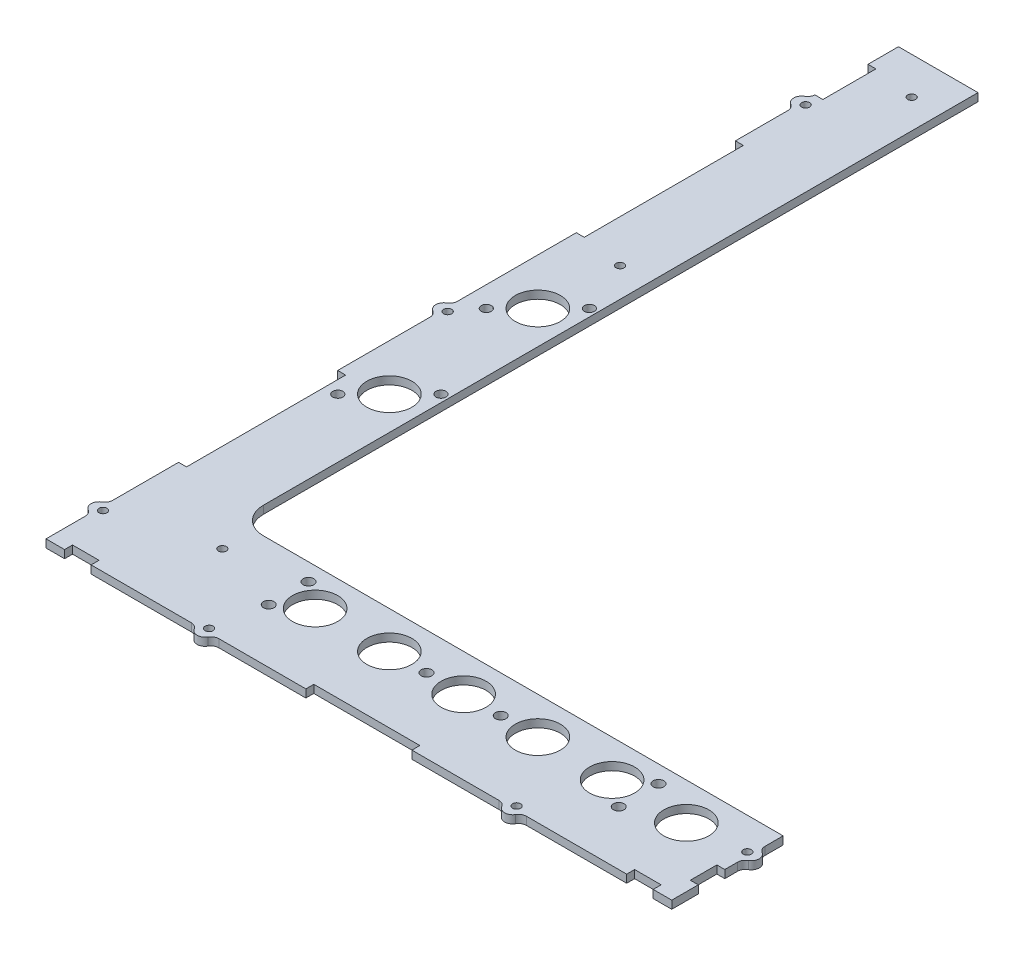
from build123d import *

# Parameters (mm, degrees)
EXTRUDE_1_DEPTH        = 3
SKETCH_2_W             = 3
SKETCH_2_H             = 10
CUT_EXTRUDE_1_DEPTH    = 3
SKETCH_4_W             = 3
SKETCH_4_H             = 3
FILLET_1_R             = 3
SKETCH_5_R             = 1.5
CUT_EXTRUDE_2_DEPTH    = 3
SKETCH_6_W             = 10
SKETCH_6_H             = 3
CUT_EXTRUDE_3_DEPTH    = 3
SKETCH_7_W             = 40
SKETCH_7_H             = 3
CUT_EXTRUDE_4_DEPTH    = 3
SKETCH_9_W             = 3
SKETCH_9_H             = 60
SKETCH_9_H_2           = 20
CUT_EXTRUDE_5_DEPTH    = 3
SKETCH_11_W            = 3
SKETCH_11_H            = 3
SKETCH_12_W            = 3
SKETCH_12_H            = 3
SKETCH_13_R            = 1.5
CUT_EXTRUDE_6_DEPTH    = 3
FILLET_2_R             = 3
SKETCH_14_W            = 3
SKETCH_14_H            = 3
SKETCH_15_W            = 3
SKETCH_15_H            = 3
SKETCH_16_W            = 3
SKETCH_16_H            = 3
FILLET_3_R             = 3
SKETCH_17_R            = 1.5
CUT_EXTRUDE_7_DEPTH    = 3
SKETCH_18_R            = 8.5
CUT_EXTRUDE_8_DEPTH    = 3
PATTERN_LINEAR_2_COUNT = 6
PATTERN_LINEAR_2_PITCH = 28
SKETCH_19_R            = 8.5
CUT_EXTRUDE_9_DEPTH    = 3
SKETCH_20_R            = 8.5
CUT_EXTRUDE_10_DEPTH   = 3
FILLET_4_R             = 10
SKETCH_21_R            = 2
CUT_EXTRUDE_11_DEPTH   = 3
SKETCH_22_R            = 1.9
CUT_EXTRUDE_12_DEPTH   = 3
SKETCH_23_R            = 1.5
CUT_EXTRUDE_13_DEPTH   = 3
SKETCH_24_R            = 1.5
CUT_EXTRUDE_14_DEPTH   = 3


with BuildPart() as part:
    # Эскиз1 → Бобышка-Вытянуть1 (new body)
    with BuildSketch(Plane(origin=(0, 0, 0), x_dir=(1, 0, 0), z_dir=(0, 1, 0))):
        Polygon((0, 0), (0, 321.5), (30, 321.5), (30, 42), (236, 42), (236, 0), align=None)
    extrude(amount=EXTRUDE_1_DEPTH)

    # Эскиз2 → Вырез-Вытянуть1 (cut)
    with BuildSketch(Plane(origin=(0, 3, 0), x_dir=(1, 0, 0), z_dir=(0, 1, 0))):
        with Locations((234.5, 15)):
            Rectangle(SKETCH_2_W, SKETCH_2_H)
    extrude(amount=-CUT_EXTRUDE_1_DEPTH, mode=Mode.SUBTRACT)

    # Эскиз4 → Повернуть1 (revolve)
    with BuildSketch(Plane(origin=(236, 0, 0), x_dir=(0, 0, -1), z_dir=(1, 0, 0))):
        with Locations((31.5, 1.5)):
            Rectangle(SKETCH_4_W, SKETCH_4_H)
    revolve(axis=Axis((236, 0, -30), (0, 1, 0)))

    # Скругление1
    fillet_1_edges = [part.edges().sort_by_distance(p)[0] for p in [
        (236, 1.5, -33),
        (236, 1.5, -27),
    ]]
    fillet(fillet_1_edges, radius=FILLET_1_R)

    # Эскиз5 → Вырез-Вытянуть2 (cut)
    with BuildSketch(Plane(origin=(0, 3, 0), x_dir=(1, 0, 0), z_dir=(0, 1, 0))):
        with Locations(Location((234.5, 30, 0), (0, 0, 270))):
            Circle(SKETCH_5_R)
    extrude(amount=-CUT_EXTRUDE_2_DEPTH, mode=Mode.SUBTRACT)

    # Эскиз6 → Вырез-Вытянуть3 (cut)
    with BuildSketch(Plane(origin=(0, 3, 0), x_dir=(1, 0, 0), z_dir=(0, 1, 0))):
        with Locations((224, 1.5)):
            Rectangle(SKETCH_6_W, SKETCH_6_H)
        with Locations((12, 1.5)):
            Rectangle(SKETCH_6_W, SKETCH_6_H)
    extrude(amount=-CUT_EXTRUDE_3_DEPTH, mode=Mode.SUBTRACT)

    # Эскиз7 → Вырез-Вытянуть4 (cut)
    with BuildSketch(Plane(origin=(0, 3, 0), x_dir=(1, 0, 0), z_dir=(0, 1, 0))):
        with Locations((118, 1.5)):
            Rectangle(SKETCH_7_W, SKETCH_7_H)
    extrude(amount=-CUT_EXTRUDE_4_DEPTH, mode=Mode.SUBTRACT)

    # Эскиз9 → Вырез-Вытянуть5 (cut)
    with BuildSketch(Plane(origin=(0, 3, 0), x_dir=(1, 0, 0), z_dir=(0, 1, 0))):
        with Locations((1.5, 80)):
            Rectangle(SKETCH_9_W, SKETCH_9_H)
        with Locations((1.5, 230)):
            Rectangle(SKETCH_9_W, SKETCH_9_H)
        with Locations((1.5, 300)):
            Rectangle(SKETCH_9_W, SKETCH_9_H_2)
    extrude(amount=-CUT_EXTRUDE_5_DEPTH, mode=Mode.SUBTRACT)

    # Эскиз11 → Повернуть2 (revolve)
    with BuildSketch(Plane.XY):
        with Locations((61.5, 1.5)):
            Rectangle(SKETCH_11_W, SKETCH_11_H)
    revolve(axis=Axis((60, 0, 0), (0, 1, 0)))

    # Эскиз12 → Повернуть3 (revolve)
    with BuildSketch(Plane.XY):
        with Locations((174.5, 1.5)):
            Rectangle(SKETCH_12_W, SKETCH_12_H)
    revolve(axis=Axis((176, 0, 0), (0, 1, 0)))

    # Эскиз13 → Вырез-Вытянуть6 (cut)
    with BuildSketch(Plane(origin=(0, 3, 0), x_dir=(1, 0, 0), z_dir=(0, 1, 0))):
        with Locations(Location((60, 1.5, 0), (0, 0, 270))):
            Circle(SKETCH_13_R)
        with Locations(Location((176, 1.5, 0), (0, 0, 270))):
            Circle(SKETCH_13_R)
    extrude(amount=-CUT_EXTRUDE_6_DEPTH, mode=Mode.SUBTRACT)

    # Скругление2
    fillet_2_edges = [part.edges().sort_by_distance(p)[0] for p in [
        (63, 1.5, 0),
        (57, 1.5, 0),
        (179, 1.5, 0),
        (173, 1.5, 0),
    ]]
    fillet(fillet_2_edges, radius=FILLET_2_R)

    # Эскиз14 → Повернуть4 (revolve)
    with BuildSketch(Plane.ZY):
        with Locations((-286.5, 1.5)):
            Rectangle(SKETCH_14_W, SKETCH_14_H)
    revolve(axis=Axis((0, 0, -285), (0, 1, 0)))

    # Эскиз15 → Повернуть5 (revolve)
    with BuildSketch(Plane.ZY):
        with Locations((-151.5, 1.5)):
            Rectangle(SKETCH_15_W, SKETCH_15_H)
    revolve(axis=Axis((0, 0, -150), (0, 1, 0)))

    # Эскиз16 → Повернуть6 (revolve)
    with BuildSketch(Plane.ZY):
        with Locations((-21.5, 1.5)):
            Rectangle(SKETCH_16_W, SKETCH_16_H)
    revolve(axis=Axis((0, 0, -20), (0, 1, 0)))

    # Скругление3
    # the kernel refuses this fillet: 3 mm, written as the material it adds along each edge
    with BuildSketch(Plane(origin=(0, 3, -282), x_dir=(-0.9659258262890682, 0, -0.2588190451025208), z_dir=(0, -1, 0)), Plane(origin=(0, 3, -147), x_dir=(-0.9659258262890682, 0, -0.2588190451025208), z_dir=(0, -1, 0))) as fillet_3_piece_1:
        with BuildLine():
            CenterArc((2.329371406, -2.897777479), FILLET_3_R, 105, 60)
            Line((-0.568406073, -2.121320344), (-0.626361623, -2.105791201))
            Line((-0.626361623, -2.105791201), (-0.05795555, 0.015529143))
            Line((-0.05795555, 0.015529143), (0.015529143, 0.05795555))
            ThreePointArc((0.015529143, 0.05795555), (0.776457135, -0.042222521), (1.537385128, 0.05795555))
            Line((1.537385128, 0.05795555), (1.552914271, 0))
        make_face()
    extrude(amount=3)
    with BuildSketch(Plane(origin=(0, 3, -288), x_dir=(0, 0, -1), z_dir=(0, -1, 0))) as fillet_3_piece_2:
        with BuildLine():
            CenterArc((2.2, -2.993325909), FILLET_3_R, 93.822553729, 56.251011404)
            Line((-0.4, -1.496662955), (-0.452, -1.466729696))
            ThreePointArc((-0.452, -1.466729696), (-0.159690158, -0.759104736), (-0.06, 0))
            Line((-0.06, 0), (0, 0.06))
            ThreePointArc((0, 0.06), (1, 0.06), (1.996, 0.059866518))
            Line((1.996, 0.059866518), (2, 0))
        make_face()
    extrude(amount=3)
    with BuildSketch(Plane(origin=(0, 3, -153), x_dir=(0, 0, -1), z_dir=(0, -1, 0)), Plane(origin=(0, 3, -23), x_dir=(0, 0, -1), z_dir=(0, -1, 0))) as fillet_3_piece_3:
        with BuildLine():
            CenterArc((2.196152423, -3), FILLET_3_R, 90, 60)
            Line((-0.401923789, -1.5), (-0.453885313, -1.47))
            ThreePointArc((-0.453885313, -1.47), (-0.160178071, -0.760927993), (-0.06, 0))
            Line((-0.06, 0), (0, 0.06))
            Line((0, 0.06), (2.196152423, 0.06))
            Line((2.196152423, 0.06), (2.196152423, 0))
        make_face()
    extrude(amount=3)
    with BuildSketch(Plane(origin=(0, 3, -17), x_dir=(0, 0, 1), z_dir=(0, -1, 0))) as fillet_3_piece_4:
        with BuildLine():
            CenterArc((2.196152423, 3), FILLET_3_R, 210, 60)
            Line((-0.401923789, 1.5), (-0.453885313, 1.47))
            ThreePointArc((-0.453885313, 1.47), (-0.160178071, 0.760927993), (-0.06, 0))
            Line((-0.06, 0), (0, -0.06))
            Line((0, -0.06), (2.196152423, -0.06))
            Line((2.196152423, -0.06), (2.196152423, 0))
        make_face()
    extrude(amount=3)

    # Эскиз17 → Вырез-Вытянуть7 (cut)
    with BuildSketch(Plane(origin=(0, 3, 0), x_dir=(1, 0, 0), z_dir=(0, 1, 0))):
        with Locations(Location((1.5, 20, 0), (0, 0, 270))):
            Circle(SKETCH_17_R)
        with Locations(Location((1.5, 150, 0), (0, 0, 270))):
            Circle(SKETCH_17_R)
        with Locations(Location((1.5, 285, 0), (0, 0, 270))):
            Circle(SKETCH_17_R)
    extrude(amount=-CUT_EXTRUDE_7_DEPTH, mode=Mode.SUBTRACT)

    # Эскиз18 → Вырез-Вытянуть8 (cut)
    with BuildSketch(Plane(origin=(0, 3, 0), x_dir=(1, 0, 0), z_dir=(0, 1, 0))):
        with Locations(Location((213.5, 28, 0), (0, 0, 270))):
            Circle(SKETCH_18_R)
    cut_extrude_8 = extrude(amount=-CUT_EXTRUDE_8_DEPTH, mode=Mode.SUBTRACT)

    # Линейный массив2: Вырез-Вытянуть8 ×6
    with Locations(*[(-i * PATTERN_LINEAR_2_PITCH, 0, 0) for i in range(1, PATTERN_LINEAR_2_COUNT)]):
        add(cut_extrude_8, mode=Mode.SUBTRACT)

    # Эскиз19 → Вырез-Вытянуть9 (cut)
    with BuildSketch(Plane(origin=(0, 3, 0), x_dir=(1, 0, 0), z_dir=(0, 1, 0))):
        with Locations(Location((17.5, 112, 0), (0, 0, 270))):
            Circle(SKETCH_19_R)
    extrude(amount=-CUT_EXTRUDE_9_DEPTH, mode=Mode.SUBTRACT)

    # Эскиз20 → Вырез-Вытянуть10 (cut)
    with BuildSketch(Plane(origin=(0, 3, 0), x_dir=(1, 0, 0), z_dir=(0, 1, 0))):
        with Locations(Location((17.5, 168, 0), (0, 0, 270))):
            Circle(SKETCH_20_R)
    extrude(amount=-CUT_EXTRUDE_10_DEPTH, mode=Mode.SUBTRACT)

    # Скругление4
    fillet_4_edges = [part.edges().sort_by_distance(p)[0] for p in [
        (30, 1.5, -42),
    ]]
    fillet(fillet_4_edges, radius=FILLET_4_R)

    # Эскиз21 → Вырез-Вытянуть11 (cut)
    with BuildSketch(Plane(origin=(0, 3, 0), x_dir=(1, 0, 0), z_dir=(0, 1, 0))):
        with Locations(Location((115.5, 28, 0), (0, 0, 270))):
            Circle(SKETCH_21_R)
        with Locations(Location((143.5, 28, 0), (0, 0, 270))):
            Circle(SKETCH_21_R)
        with Locations(Location((195.5, 35.5, 0), (0, 0, 270))):
            Circle(SKETCH_21_R)
        with Locations(Location((195.5, 20.5, 0), (0, 0, 270))):
            Circle(SKETCH_21_R)
        with Locations(Location((63.5, 35.5, 0), (0, 0, 270))):
            Circle(SKETCH_21_R)
        with Locations(Location((63.5, 20.5, 0), (0, 0, 270))):
            Circle(SKETCH_21_R)
    extrude(amount=-CUT_EXTRUDE_11_DEPTH, mode=Mode.SUBTRACT)

    # Эскиз22 → Вырез-Вытянуть12 (cut)
    with BuildSketch(Plane(origin=(0, 3, 0), x_dir=(1, 0, 0), z_dir=(0, 1, 0))):
        with Locations(Location((27.222718241, 121.722718241, 0), (0, 0, 270))):
            Circle(SKETCH_22_R)
        with Locations(Location((7.777281759, 102.277281759, 0), (0, 0, 270))):
            Circle(SKETCH_22_R)
        with Locations(Location((27.222718241, 177.722718241, 0), (0, 0, 270))):
            Circle(SKETCH_22_R)
        with Locations(Location((7.777281759, 158.277281759, 0), (0, 0, 270))):
            Circle(SKETCH_22_R)
    extrude(amount=-CUT_EXTRUDE_12_DEPTH, mode=Mode.SUBTRACT)

    # Эскиз23 → Вырез-Вытянуть13 (cut)
    with BuildSketch(Plane(origin=(0, 3, 0), x_dir=(1, 0, 0), z_dir=(0, 1, 0))):
        with Locations(Location((19, 307.5, 0), (0, 0, 270))):
            Circle(SKETCH_23_R)
        with Locations(Location((19, 197.5, 0), (0, 0, 270))):
            Circle(SKETCH_23_R)
    extrude(amount=-CUT_EXTRUDE_13_DEPTH, mode=Mode.SUBTRACT)

    # Эскиз24 → Вырез-Вытянуть14 (cut)
    with BuildSketch(Plane(origin=(0, 3, 0), x_dir=(1, 0, 0), z_dir=(0, 1, 0))):
        with Locations(Location((36.5, 30, 0), (0, 0, 270))):
            Circle(SKETCH_24_R)
    extrude(amount=-CUT_EXTRUDE_14_DEPTH, mode=Mode.SUBTRACT)


solid = part.part
